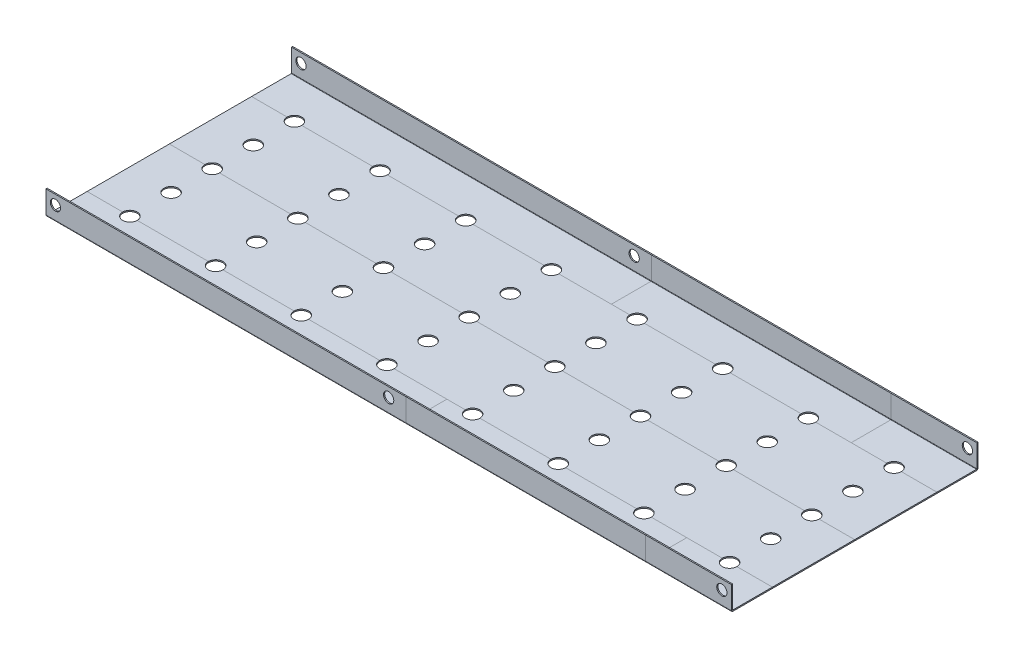
from build123d import *

# Parameters (mm, degrees)
SKETCH_1_W                         = 400
SKETCH_1_H                         = 144
SKETCH_1_R                         = 4.25
SM_BASE_FLANGE_1_DEPTH             = 0.7
SM_EDGE_FLANGE_1_STRIP_W           = 3.2
SM_EDGE_FLANGE_1_STRIP_H           = 0.7
SM_EDGE_FLANGE_1_STRIP_CUT_DEPTH   = 400
SM_EDGE_FLANGE_1_STRIP_2_W         = 3.2
SM_EDGE_FLANGE_1_STRIP_2_H         = 0.7
SM_EDGE_FLANGE_1_STRIP_CUT_2_DEPTH = 400
SM_EDGE_FLANGE_1_DEPTH             = 400
SM_EDGE_FLANGE_1_BEND_DEPTH        = 400
SKETCH_14_R                        = 3
CUT_EXTRUDE_1_DEPTH                = 10
CUT_EXTRUDE_START                  = -10
SKETCH_15_R                        = 3
CUT_EXTRUDE_2_DEPTH                = 10
SPLIT_BODIES_5_OUTLINE_W           = 400
SPLIT_BODIES_5_OUTLINE_H           = 14
SPLIT_BODIES_5_OUTLINE_R           = 3
SPLIT_BODIES_5_DEPTH               = 72
SPLIT_START                        = -72
SPLIT_BODIES_5_2_OUTLINE_W         = 400
SPLIT_BODIES_5_2_OUTLINE_H         = 14
SPLIT_BODIES_5_2_OUTLINE_R         = 3
SPLIT_BODIES_5_2_DEPTH             = 24
SPLIT_START_2                      = 150
SPLIT_BODIES_5_3_DEPTH             = 20.75
SPLIT_START_3                      = 179.25
SPLIT_BODIES_5_4_DEPTH             = 12.2499999
SPLIT_START_4                      = 197.5000001
SPLIT_BODIES_5_5_DEPTH             = 2.4999999
SPLIT_START_5                      = 170.75
SPLIT_BODIES_5_6_DEPTH             = 26.7500001
SPLIT_START_6                      = -0.7
SPLIT_BODIES_5_9_OUTLINE_R         = 4.25
SPLIT_BODIES_5_9_DEPTH             = 0.7
SPLIT_START_7                      = 0.2
SPLIT_BODIES_5_10_OUTLINE_W        = 210
SPLIT_BODIES_5_10_OUTLINE_H        = 0.7
SPLIT_BODIES_5_10_DEPTH            = 4.5999999
SPLIT_START_8                      = 10.8000001
SPLIT_BODIES_5_11_OUTLINE_W        = 210
SPLIT_BODIES_5_11_OUTLINE_H        = 0.7
SPLIT_BODIES_5_11_DEPTH            = 2.4999999
SPLIT_BODIES_5_12_DEPTH            = 0.9
SPLIT_START_9                      = 4.7999999
SPLIT_BODIES_5_13_OUTLINE_W        = 210
SPLIT_BODIES_5_13_OUTLINE_H        = 0.7
SPLIT_BODIES_5_13_DEPTH            = 6.0000002
SPLIT_START_10                     = -201
SPLIT_BODIES_5_14_DEPTH            = 212
SPLIT_START_11                     = 70
SPLIT_BODIES_5_15_OUTLINE_R        = 3
SPLIT_BODIES_5_15_DEPTH            = 3
SPLIT_BODIES_5_16_OUTLINE_W        = 140
SPLIT_BODIES_5_16_OUTLINE_H        = 0.7
SPLIT_BODIES_5_16_DEPTH            = 13.1
SPLIT_START_12                     = 10
SPLIT_BODIES_5_17_DEPTH            = 140
SPLIT_BODIES_5_18_DEPTH            = 0.7
SPLIT_BODIES_5_19_DEPTH            = 20.75
SPLIT_BODIES_5_20_DEPTH            = 12.2499999
SPLIT_BODIES_5_21_DEPTH            = 2.4999999
SPLIT_BODIES_5_22_DEPTH            = 26.7500001
SPLIT_BODIES_5_25_OUTLINE_W        = 140
SPLIT_BODIES_5_25_OUTLINE_H        = 0.7
SPLIT_BODIES_5_25_DEPTH            = 13.1
SPLIT_BODIES_5_26_DEPTH            = 140
SPLIT_BODIES_5_27_DEPTH            = 0.7
SPLIT_BODIES_5_28_OUTLINE_W        = 210
SPLIT_BODIES_5_28_OUTLINE_H        = 0.7
SPLIT_BODIES_5_28_DEPTH            = 4.5999999
SPLIT_BODIES_5_29_OUTLINE_W        = 210
SPLIT_BODIES_5_29_OUTLINE_H        = 0.7
SPLIT_BODIES_5_29_DEPTH            = 2.4999999
SPLIT_BODIES_5_30_DEPTH            = 0.9
SPLIT_BODIES_5_31_OUTLINE_W        = 210
SPLIT_BODIES_5_31_OUTLINE_H        = 0.7
SPLIT_BODIES_5_31_DEPTH            = 6.0000002
SPLIT_BODIES_5_32_DEPTH            = 212
SPLIT_START_13                     = -73
SPLIT_BODIES_5_33_OUTLINE_R        = 3
SPLIT_BODIES_5_33_DEPTH            = 3


with BuildPart() as part:
    # 基体-法兰1: sheet metal written as solids
    # Sketch 1 → 基体-法兰1 (new body)
    with BuildSketch(Plane(origin=(0, 0, 0), x_dir=(1, 0, 0), z_dir=(0, 1, 0))):
        Rectangle(SKETCH_1_W, SKETCH_1_H)
        with Locations(Location((-175, -48, 0), (0, 0, 270))):
            Circle(SKETCH_1_R, mode=Mode.SUBTRACT)
        with Locations(Location((-175, -24, 0), (0, 0, 270))):
            Circle(SKETCH_1_R, mode=Mode.SUBTRACT)
        with Locations(Location((-175, 0, 0), (0, 0, 270))):
            Circle(SKETCH_1_R, mode=Mode.SUBTRACT)
        with Locations(Location((-175, 24, 0), (0, 0, 270))):
            Circle(SKETCH_1_R, mode=Mode.SUBTRACT)
        with Locations(Location((-175, 48, 0), (0, 0, 270))):
            Circle(SKETCH_1_R, mode=Mode.SUBTRACT)
        with Locations(Location((-125, -48, 0), (0, 0, 90))):
            Circle(SKETCH_1_R, mode=Mode.SUBTRACT)
        with Locations(Location((-125, -24, 0), (0, 0, 90))):
            Circle(SKETCH_1_R, mode=Mode.SUBTRACT)
        with Locations(Location((-125, 0, 0), (0, 0, 90))):
            Circle(SKETCH_1_R, mode=Mode.SUBTRACT)
        with Locations(Location((-125, 24, 0), (0, 0, 90))):
            Circle(SKETCH_1_R, mode=Mode.SUBTRACT)
        with Locations(Location((-125, 48, 0), (0, 0, 90))):
            Circle(SKETCH_1_R, mode=Mode.SUBTRACT)
        with Locations(Location((-75, -48, 0), (0, 0, 270))):
            Circle(SKETCH_1_R, mode=Mode.SUBTRACT)
        with Locations(Location((-25, -48, 0), (0, 0, 90))):
            Circle(SKETCH_1_R, mode=Mode.SUBTRACT)
        with Locations(Location((-25, -24, 0), (0, 0, 90))):
            Circle(SKETCH_1_R, mode=Mode.SUBTRACT)
        with Locations(Location((-75, -24, 0), (0, 0, 270))):
            Circle(SKETCH_1_R, mode=Mode.SUBTRACT)
        with Locations(Location((-75, 0, 0), (0, 0, 270))):
            Circle(SKETCH_1_R, mode=Mode.SUBTRACT)
        with Locations(Location((-25, 0, 0), (0, 0, 90))):
            Circle(SKETCH_1_R, mode=Mode.SUBTRACT)
        with Locations(Location((-75, 24, 0), (0, 0, 270))):
            Circle(SKETCH_1_R, mode=Mode.SUBTRACT)
        with Locations(Location((-25, 24, 0), (0, 0, 90))):
            Circle(SKETCH_1_R, mode=Mode.SUBTRACT)
        with Locations(Location((-25, 48, 0), (0, 0, 90))):
            Circle(SKETCH_1_R, mode=Mode.SUBTRACT)
        with Locations(Location((-75, 48, 0), (0, 0, 270))):
            Circle(SKETCH_1_R, mode=Mode.SUBTRACT)
        with Locations(Location((25, 48, 0), (0, 0, 270))):
            Circle(SKETCH_1_R, mode=Mode.SUBTRACT)
        with Locations(Location((25, 24, 0), (0, 0, 270))):
            Circle(SKETCH_1_R, mode=Mode.SUBTRACT)
        with Locations(Location((25, 0, 0), (0, 0, 270))):
            Circle(SKETCH_1_R, mode=Mode.SUBTRACT)
        with Locations(Location((25, -24, 0), (0, 0, 270))):
            Circle(SKETCH_1_R, mode=Mode.SUBTRACT)
        with Locations(Location((25, -48, 0), (0, 0, 270))):
            Circle(SKETCH_1_R, mode=Mode.SUBTRACT)
        with Locations(Location((75, -48, 0), (0, 0, 90))):
            Circle(SKETCH_1_R, mode=Mode.SUBTRACT)
        with Locations(Location((75, -24, 0), (0, 0, 90))):
            Circle(SKETCH_1_R, mode=Mode.SUBTRACT)
        with Locations(Location((75, 0, 0), (0, 0, 90))):
            Circle(SKETCH_1_R, mode=Mode.SUBTRACT)
        with Locations(Location((75, 24, 0), (0, 0, 90))):
            Circle(SKETCH_1_R, mode=Mode.SUBTRACT)
        with Locations(Location((75, 48, 0), (0, 0, 90))):
            Circle(SKETCH_1_R, mode=Mode.SUBTRACT)
        with Locations(Location((125, 48, 0), (0, 0, 270))):
            Circle(SKETCH_1_R, mode=Mode.SUBTRACT)
        with Locations(Location((125, 24, 0), (0, 0, 270))):
            Circle(SKETCH_1_R, mode=Mode.SUBTRACT)
        with Locations(Location((125, 0, 0), (0, 0, 270))):
            Circle(SKETCH_1_R, mode=Mode.SUBTRACT)
        with Locations(Location((125, -24, 0), (0, 0, 270))):
            Circle(SKETCH_1_R, mode=Mode.SUBTRACT)
        with Locations(Location((125, -48, 0), (0, 0, 270))):
            Circle(SKETCH_1_R, mode=Mode.SUBTRACT)
        with Locations(Location((175, -48, 0), (0, 0, 90))):
            Circle(SKETCH_1_R, mode=Mode.SUBTRACT)
        with Locations(Location((175, -24, 0), (0, 0, 90))):
            Circle(SKETCH_1_R, mode=Mode.SUBTRACT)
        with Locations(Location((175, 0, 0), (0, 0, 90))):
            Circle(SKETCH_1_R, mode=Mode.SUBTRACT)
        with Locations(Location((175, 24, 0), (0, 0, 90))):
            Circle(SKETCH_1_R, mode=Mode.SUBTRACT)
        with Locations(Location((175, 48, 0), (0, 0, 90))):
            Circle(SKETCH_1_R, mode=Mode.SUBTRACT)
    extrude(amount=-SM_BASE_FLANGE_1_DEPTH)

    # 边线-法兰1: sheet metal written as solids
    # 边线-法兰1 strip (on a plane across the edge) → 边线-法兰1 strip cut (cut)
    with BuildSketch(Plane(origin=(-200, 0, 72), x_dir=(0, 0, -1), z_dir=(1, 0, 0))):
        with Locations((-0.7, -0.35)):
            Rectangle(SM_EDGE_FLANGE_1_STRIP_W, SM_EDGE_FLANGE_1_STRIP_H)
    extrude(amount=SM_EDGE_FLANGE_1_STRIP_CUT_DEPTH, mode=Mode.SUBTRACT)

    # 边线-法兰1 strip 2 (on a plane across the edge) → 边线-法兰1 strip cut 2 (cut)
    with BuildSketch(Plane(origin=(200, 0, -72), x_dir=(0, 0, 1), z_dir=(-1, 0, 0))):
        with Locations((-0.7, -0.35)):
            Rectangle(SM_EDGE_FLANGE_1_STRIP_2_W, SM_EDGE_FLANGE_1_STRIP_2_H)
    extrude(amount=SM_EDGE_FLANGE_1_STRIP_CUT_2_DEPTH, mode=Mode.SUBTRACT)

    # 边线-法兰1 section (on a plane across the edge) → 边线-法兰1 (add)
    with BuildSketch(Plane(origin=(-200, 0, 72), x_dir=(0, 0, -1), z_dir=(1, 0, 0))):
        with BuildLine():
            Line((0, 0.2), (0, 13.3))
            Line((0, 13.3), (0.7, 13.3))
            Line((0.7, 13.3), (0.7, 0.2))
            ThreePointArc((0.7, 0.2), (0.758578644, 0.058578644), (0.9, 0))
            Line((0.9, 0), (0.9, -0.7))
            ThreePointArc((0.9, -0.7), (0.263603897, -0.436396103), (0, 0.2))
        make_face()
    extrude(amount=SM_EDGE_FLANGE_1_DEPTH)

    # 边线-法兰1 section 2 (on a plane across the edge) → 边线-法兰1 bend (add)
    with BuildSketch(Plane(origin=(200, 0, -72), x_dir=(0, 0, 1), z_dir=(-1, 0, 0))):
        with BuildLine():
            Line((0, 0.2), (0, 13.3))
            Line((0, 13.3), (0.7, 13.3))
            Line((0.7, 13.3), (0.7, 0.2))
            ThreePointArc((0.7, 0.2), (0.758578644, 0.058578644), (0.9, 0))
            Line((0.9, 0), (0.9, -0.7))
            ThreePointArc((0.9, -0.7), (0.263603897, -0.436396103), (0, 0.2))
        make_face()
    extrude(amount=SM_EDGE_FLANGE_1_BEND_DEPTH)

    # Sketch 14 → 切除-拉伸1 (cut)
    with BuildSketch(Plane.XY.offset(72)):
        with Locations((-194.5, 7.8)):
            Circle(SKETCH_14_R)
        with Locations((0, 7.8)):
            Circle(SKETCH_14_R)
        with Locations(Location((194.5, 7.8, 0), (0, 0, 180))):
            Circle(SKETCH_14_R)
    extrude(amount=-CUT_EXTRUDE_1_DEPTH, mode=Mode.SUBTRACT)

    # Sketch 15 → 切除-拉伸2 (cut)
    with BuildSketch(Plane(origin=(0, 0, -72), x_dir=(-1, 0, 0), z_dir=(0, 0, -1)).offset(CUT_EXTRUDE_START)):
        with Locations((-194.5, 7.8)):
            Circle(SKETCH_15_R)
        with Locations(Location((0, 7.8, 0), (0, 0, 180))):
            Circle(SKETCH_15_R)
        with Locations(Location((194.5, 7.8, 0), (0, 0, 180))):
            Circle(SKETCH_15_R)
    extrude(amount=CUT_EXTRUDE_2_DEPTH, mode=Mode.SUBTRACT)

    # Split Bodies 5: read off the stored shape, not the designer's step
    # Split Bodies 5 outline → Split Bodies 5 (cut)
    with BuildSketch(Plane.XY):
        with Locations((0, 6.3)):
            Rectangle(SPLIT_BODIES_5_OUTLINE_W, SPLIT_BODIES_5_OUTLINE_H)
        with Locations((194.5, 7.8)):
            Circle(SPLIT_BODIES_5_OUTLINE_R, mode=Mode.SUBTRACT)
        with Locations((-194.5, 7.8)):
            Circle(SPLIT_BODIES_5_OUTLINE_R, mode=Mode.SUBTRACT)
        with Locations((0, 7.8)):
            Circle(SPLIT_BODIES_5_OUTLINE_R, mode=Mode.SUBTRACT)
    extrude(amount=SPLIT_BODIES_5_DEPTH, mode=Mode.SUBTRACT)

    # Split Bodies 5 2 outline → Split Bodies 5 2 (cut)
    with BuildSketch(Plane.XY.offset(SPLIT_START)):
        with Locations((0, 6.3)):
            Rectangle(SPLIT_BODIES_5_2_OUTLINE_W, SPLIT_BODIES_5_2_OUTLINE_H)
        with Locations((194.5, 7.8)):
            Circle(SPLIT_BODIES_5_2_OUTLINE_R, mode=Mode.SUBTRACT)
        with Locations((-194.5, 7.8)):
            Circle(SPLIT_BODIES_5_2_OUTLINE_R, mode=Mode.SUBTRACT)
        with Locations((0, 7.8)):
            Circle(SPLIT_BODIES_5_2_OUTLINE_R, mode=Mode.SUBTRACT)
    extrude(amount=SPLIT_BODIES_5_2_DEPTH, mode=Mode.SUBTRACT)


with BuildPart() as body_2:
    # Split Bodies 5 3 outline → Split Bodies 5 3 (new body)
    with BuildSketch(Plane.YZ.offset(SPLIT_START_2)):
        with BuildLine():
            Line((-0.7, 71.1), (-0.7, 48))
            Line((-0.7, 48), (0, 48))
            Line((0, 48), (0, 71.1))
            ThreePointArc((0, 71.1), (0.058578644, 71.241421356), (0.2, 71.3))
            Line((0.2, 71.3), (13.3, 71.3))
            Line((13.3, 71.3), (13.3, 72))
            Line((13.3, 72), (0.2, 72))
            ThreePointArc((0.2, 72), (-0.436396103, 71.736396103), (-0.7, 71.1))
        make_face()
    extrude(amount=SPLIT_BODIES_5_3_DEPTH)

    # Split Bodies 5 4 outline → Split Bodies 5 4 (add)
    with BuildSketch(Plane.YZ.offset(SPLIT_START_3)):
        with BuildLine():
            Line((-0.7, 71.1), (-0.7, 48))
            Line((-0.7, 48), (0, 48))
            Line((0, 48), (0, 71.1))
            ThreePointArc((0, 71.1), (0.058578644, 71.241421356), (0.2, 71.3))
            Line((0.2, 71.3), (13.3, 71.3))
            Line((13.3, 71.3), (13.3, 72))
            Line((13.3, 72), (0.2, 72))
            ThreePointArc((0.2, 72), (-0.436396103, 71.736396103), (-0.7, 71.1))
        make_face()
    extrude(amount=SPLIT_BODIES_5_4_DEPTH)

    # Split Bodies 5 5 outline → Split Bodies 5 5 (add)
    with BuildSketch(Plane.YZ.offset(SPLIT_START_4)):
        with BuildLine():
            Line((-0.7, 71.1), (-0.7, 48))
            Line((-0.7, 48), (0, 48))
            Line((0, 48), (0, 71.1))
            ThreePointArc((0, 71.1), (0.058578644, 71.241421356), (0.2, 71.3))
            Line((0.2, 71.3), (13.3, 71.3))
            Line((13.3, 71.3), (13.3, 72))
            Line((13.3, 72), (0.2, 72))
            ThreePointArc((0.2, 72), (-0.436396103, 71.736396103), (-0.7, 71.1))
        make_face()
    extrude(amount=SPLIT_BODIES_5_5_DEPTH)

    # Split Bodies 5 6 outline → Split Bodies 5 6 (add)
    with BuildSketch(Plane.YZ.offset(SPLIT_START_5)):
        with BuildLine():
            Line((-0.7, 71.1), (-0.7, 48))
            Line((-0.7, 48), (0, 48))
            Line((0, 48), (0, 71.1))
            ThreePointArc((0, 71.1), (0.058578644, 71.241421356), (0.2, 71.3))
            Line((0.2, 71.3), (13.3, 71.3))
            Line((13.3, 71.3), (13.3, 72))
            Line((13.3, 72), (0.2, 72))
            ThreePointArc((0.2, 72), (-0.436396103, 71.736396103), (-0.7, 71.1))
        make_face()
    extrude(amount=SPLIT_BODIES_5_6_DEPTH)

    # Split Bodies 5 7: loft between two sections, ruled curve by curve
    split_bodies_5_7_from = [
        Edge.make_three_point_arc((191.5, 7.8, 71.3), (194.5, 4.8, 71.3), (197.5, 7.8, 71.3)),
        Edge.make_three_point_arc((197.5, 7.8, 71.3), (194.5, 10.8, 71.3), (191.5, 7.8, 71.3)),
    ]
    split_bodies_5_7_to = [
        Edge.make_three_point_arc((191.5, 7.8, 72), (194.5, 4.8, 72), (197.5, 7.8, 72)),
        Edge.make_three_point_arc((197.5, 7.8, 72), (194.5, 10.8, 72), (191.5, 7.8, 72)),
    ]
    split_bodies_5_7 = Solid(Shell([*[Face.make_surface_from_curves(split_bodies_5_7_from[k], split_bodies_5_7_to[k]) for k in range(2)], Face(Wire(split_bodies_5_7_from)), Face(Wire(split_bodies_5_7_to))]))
    add(split_bodies_5_7, mode=Mode.SUBTRACT)

    # Split Bodies 5 8: loft between two sections, ruled curve by curve
    split_bodies_5_8_from = [
        Edge.make_three_point_arc((170.75, -0.7, 48), (171.99479618, -0.7, 51.00520382), (175, -0.7, 52.25)),
        Edge.make_three_point_arc((175, -0.7, 52.25), (178.00520382, -0.7, 51.00520382), (179.25, -0.7, 48)),
        Edge.make_line((179.25, -0.7, 48), (170.75, -0.7, 48)),
    ]
    split_bodies_5_8_to = [
        Edge.make_three_point_arc((170.75, 0, 48), (171.99479618, 0, 51.00520382), (175, 0, 52.25)),
        Edge.make_three_point_arc((175, 0, 52.25), (178.00520382, 0, 51.00520382), (179.25, 0, 48)),
        Edge.make_line((179.25, 0, 48), (170.75, 0, 48)),
    ]
    split_bodies_5_8 = Solid(Shell([*[Face.make_surface_from_curves(split_bodies_5_8_from[k], split_bodies_5_8_to[k]) for k in range(3)], Face(Wire(split_bodies_5_8_from)), Face(Wire(split_bodies_5_8_to))]))
    add(split_bodies_5_8, mode=Mode.SUBTRACT)


with BuildPart() as body_3:
    # Split Bodies 5 9 outline → Split Bodies 5 9 (new body)
    with BuildSketch(Plane(origin=(0, 0, 0), x_dir=(1, 0, 0), z_dir=(0, 1, 0)).offset(SPLIT_START_6)):
        with BuildLine():
            Line((-200, -48), (-179.25, -48))
            ThreePointArc((-179.25, -48), (-175, -43.75), (-170.75, -48))
            Line((-170.75, -48), (-129.25, -48))
            ThreePointArc((-129.25, -48), (-125, -43.75), (-120.75, -48))
            Line((-120.75, -48), (-79.25, -48))
            ThreePointArc((-79.25, -48), (-75, -43.75), (-70.75, -48))
            Line((-70.75, -48), (-29.25, -48))
            ThreePointArc((-29.25, -48), (-25, -43.75), (-20.75, -48))
            Line((-20.75, -48), (20.75, -48))
            ThreePointArc((20.75, -48), (25, -43.75), (29.25, -48))
            Line((29.25, -48), (70.75, -48))
            ThreePointArc((70.75, -48), (75, -43.75), (79.25, -48))
            Line((79.25, -48), (120.75, -48))
            ThreePointArc((120.75, -48), (125, -43.75), (129.25, -48))
            Line((129.25, -48), (170.75, -48))
            ThreePointArc((170.75, -48), (175, -43.75), (179.25, -48))
            Line((179.25, -48), (200, -48))
            Line((200, -48), (200, 0))
            Line((200, 0), (179.25, 0))
            ThreePointArc((179.25, 0), (175, -4.25), (170.75, 0))
            Line((170.75, 0), (129.25, 0))
            ThreePointArc((129.25, 0), (125, -4.25), (120.75, 0))
            Line((120.75, 0), (79.25, 0))
            ThreePointArc((79.25, 0), (75, -4.25), (70.75, 0))
            Line((70.75, 0), (29.25, 0))
            ThreePointArc((29.25, 0), (25, -4.25), (20.75, 0))
            Line((20.75, 0), (-20.75, 0))
            ThreePointArc((-20.75, 0), (-25, -4.25), (-29.25, 0))
            Line((-29.25, 0), (-70.75, 0))
            ThreePointArc((-70.75, 0), (-75, -4.25), (-79.25, 0))
            Line((-79.25, 0), (-120.75, 0))
            ThreePointArc((-120.75, 0), (-125, -4.25), (-129.25, 0))
            Line((-129.25, 0), (-170.75, 0))
            ThreePointArc((-170.75, 0), (-175, -4.25), (-179.25, 0))
            Line((-179.25, 0), (-200, 0))
            Line((-200, 0), (-200, -48))
        make_face()
        with Locations((-175, -24)):
            Circle(SPLIT_BODIES_5_9_OUTLINE_R, mode=Mode.SUBTRACT)
        with Locations((-125, -24)):
            Circle(SPLIT_BODIES_5_9_OUTLINE_R, mode=Mode.SUBTRACT)
        with Locations((-75, -24)):
            Circle(SPLIT_BODIES_5_9_OUTLINE_R, mode=Mode.SUBTRACT)
        with Locations((-25, -24)):
            Circle(SPLIT_BODIES_5_9_OUTLINE_R, mode=Mode.SUBTRACT)
        with Locations((25, -24)):
            Circle(SPLIT_BODIES_5_9_OUTLINE_R, mode=Mode.SUBTRACT)
        with Locations((75, -24)):
            Circle(SPLIT_BODIES_5_9_OUTLINE_R, mode=Mode.SUBTRACT)
        with Locations((125, -24)):
            Circle(SPLIT_BODIES_5_9_OUTLINE_R, mode=Mode.SUBTRACT)
        with Locations((175, -24)):
            Circle(SPLIT_BODIES_5_9_OUTLINE_R, mode=Mode.SUBTRACT)
    extrude(amount=SPLIT_BODIES_5_9_DEPTH)


with BuildPart() as body_4:
    # Split Bodies 5 10 outline → Split Bodies 5 10 (new body)
    with BuildSketch(Plane(origin=(0, 0, 0), x_dir=(1, 0, 0), z_dir=(0, 1, 0)).offset(SPLIT_START_7)):
        with Locations((-95, -71.65)):
            Rectangle(SPLIT_BODIES_5_10_OUTLINE_W, SPLIT_BODIES_5_10_OUTLINE_H)
    extrude(amount=SPLIT_BODIES_5_10_DEPTH)

    # Split Bodies 5 11 outline → Split Bodies 5 11 (add)
    with BuildSketch(Plane(origin=(0, 0, 0), x_dir=(1, 0, 0), z_dir=(0, 1, 0)).offset(SPLIT_START_8)):
        with Locations((-95, -71.65)):
            Rectangle(SPLIT_BODIES_5_11_OUTLINE_W, SPLIT_BODIES_5_11_OUTLINE_H)
    extrude(amount=SPLIT_BODIES_5_11_DEPTH)

    # Split Bodies 5 12 outline → Split Bodies 5 12 (add)
    with BuildSketch(Plane(origin=(0, 0, 0), x_dir=(1, 0, 0), z_dir=(0, 1, 0)).offset(SPLIT_START_6)):
        with BuildLine():
            Line((10, -48), (-20.75, -48))
            ThreePointArc((-20.75, -48), (-25, -52.25), (-29.25, -48))
            Line((-29.25, -48), (-70.75, -48))
            ThreePointArc((-70.75, -48), (-75, -52.25), (-79.25, -48))
            Line((-79.25, -48), (-120.75, -48))
            ThreePointArc((-120.75, -48), (-125, -52.25), (-129.25, -48))
            Line((-129.25, -48), (-170.75, -48))
            ThreePointArc((-170.75, -48), (-175, -52.25), (-179.25, -48))
            Line((-179.25, -48), (-200, -48))
            Line((-200, -48), (-200, -72))
            Line((-200, -72), (10, -72))
            Line((10, -72), (10, -48))
        make_face()
    extrude(amount=SPLIT_BODIES_5_12_DEPTH)

    # Split Bodies 5 13 outline → Split Bodies 5 13 (add)
    with BuildSketch(Plane(origin=(0, 0, 0), x_dir=(1, 0, 0), z_dir=(0, 1, 0)).offset(SPLIT_START_9)):
        with Locations((-95, -71.65)):
            Rectangle(SPLIT_BODIES_5_13_OUTLINE_W, SPLIT_BODIES_5_13_OUTLINE_H)
    extrude(amount=SPLIT_BODIES_5_13_DEPTH)

    # Split Bodies 5 14 outline → Split Bodies 5 14 (cut)
    with BuildSketch(Plane.YZ.offset(SPLIT_START_10)):
        with BuildLine():
            Line((0, 71.1), (0, 48))
            Line((0, 48), (0.2, 48))
            Line((0.2, 48), (0.2, 71.3))
            ThreePointArc((0.2, 71.3), (0.058578644, 71.241421356), (0, 71.1))
        make_face()
        with BuildLine():
            Line((-0.7, 72), (-0.7, 71.1))
            ThreePointArc((-0.7, 71.1), (-0.436396103, 71.736396103), (0.2, 72))
            Line((0.2, 72), (-0.7, 72))
        make_face()
    extrude(amount=SPLIT_BODIES_5_14_DEPTH, mode=Mode.SUBTRACT)

    # Split Bodies 5 15 outline → Split Bodies 5 15 (cut)
    with BuildSketch(Plane.XY.offset(SPLIT_START_11)):
        with Locations((0, 7.8)):
            Circle(SPLIT_BODIES_5_15_OUTLINE_R)
        with Locations((-194.5, 7.8)):
            Circle(SPLIT_BODIES_5_15_OUTLINE_R)
    extrude(amount=SPLIT_BODIES_5_15_DEPTH, mode=Mode.SUBTRACT)


with BuildPart() as body_5:
    # Split Bodies 5 16 outline → Split Bodies 5 16 (new body)
    with BuildSketch(Plane(origin=(0, 0, 0), x_dir=(1, 0, 0), z_dir=(0, 1, 0)).offset(SPLIT_START_7)):
        with Locations((80, -71.65)):
            Rectangle(SPLIT_BODIES_5_16_OUTLINE_W, SPLIT_BODIES_5_16_OUTLINE_H)
    extrude(amount=SPLIT_BODIES_5_16_DEPTH)

    # Split Bodies 5 17 outline → Split Bodies 5 17 (add)
    with BuildSketch(Plane.YZ.offset(SPLIT_START_12)):
        with BuildLine():
            Line((-0.7, 71.1), (-0.7, 48))
            Line((-0.7, 48), (0, 48))
            Line((0, 48), (0, 71.1))
            ThreePointArc((0, 71.1), (0.058578644, 71.241421356), (0.2, 71.3))
            Line((0.2, 71.3), (0.2, 72))
            ThreePointArc((0.2, 72), (-0.436396103, 71.736396103), (-0.7, 71.1))
        make_face()
    extrude(amount=SPLIT_BODIES_5_17_DEPTH)

    # Split Bodies 5 18 outline → Split Bodies 5 18 (cut)
    with BuildSketch(Plane(origin=(0, 0, 0), x_dir=(1, 0, 0), z_dir=(0, 1, 0)).offset(SPLIT_START_6)):
        with BuildLine():
            Line((129.25, -48), (120.75, -48))
            ThreePointArc((120.75, -48), (125, -52.25), (129.25, -48))
        make_face()
        with BuildLine():
            ThreePointArc((20.75, -48), (25, -52.25), (29.25, -48))
            Line((29.25, -48), (20.75, -48))
        make_face()
        with BuildLine():
            ThreePointArc((70.75, -48), (75, -52.25), (79.25, -48))
            Line((79.25, -48), (70.75, -48))
        make_face()
    extrude(amount=SPLIT_BODIES_5_18_DEPTH, mode=Mode.SUBTRACT)


with BuildPart() as body_6:
    # Split Bodies 5 19 outline → Split Bodies 5 19 (new body)
    with BuildSketch(Plane.YZ.offset(SPLIT_START_2)):
        with BuildLine():
            Line((0, -48), (-0.7, -48))
            Line((-0.7, -48), (-0.7, -71.1))
            ThreePointArc((-0.7, -71.1), (-0.436396103, -71.736396103), (0.2, -72))
            Line((0.2, -72), (13.3, -72))
            Line((13.3, -72), (13.3, -71.3))
            Line((13.3, -71.3), (0.2, -71.3))
            ThreePointArc((0.2, -71.3), (0.058578644, -71.241421356), (0, -71.1))
            Line((0, -71.1), (0, -48))
        make_face()
    extrude(amount=SPLIT_BODIES_5_19_DEPTH)

    # Split Bodies 5 20 outline → Split Bodies 5 20 (add)
    with BuildSketch(Plane.YZ.offset(SPLIT_START_3)):
        with BuildLine():
            Line((0, -48), (-0.7, -48))
            Line((-0.7, -48), (-0.7, -71.1))
            ThreePointArc((-0.7, -71.1), (-0.436396103, -71.736396103), (0.2, -72))
            Line((0.2, -72), (13.3, -72))
            Line((13.3, -72), (13.3, -71.3))
            Line((13.3, -71.3), (0.2, -71.3))
            ThreePointArc((0.2, -71.3), (0.058578644, -71.241421356), (0, -71.1))
            Line((0, -71.1), (0, -48))
        make_face()
    extrude(amount=SPLIT_BODIES_5_20_DEPTH)

    # Split Bodies 5 21 outline → Split Bodies 5 21 (add)
    with BuildSketch(Plane.YZ.offset(SPLIT_START_4)):
        with BuildLine():
            Line((0, -48), (-0.7, -48))
            Line((-0.7, -48), (-0.7, -71.1))
            ThreePointArc((-0.7, -71.1), (-0.436396103, -71.736396103), (0.2, -72))
            Line((0.2, -72), (13.3, -72))
            Line((13.3, -72), (13.3, -71.3))
            Line((13.3, -71.3), (0.2, -71.3))
            ThreePointArc((0.2, -71.3), (0.058578644, -71.241421356), (0, -71.1))
            Line((0, -71.1), (0, -48))
        make_face()
    extrude(amount=SPLIT_BODIES_5_21_DEPTH)

    # Split Bodies 5 22 outline → Split Bodies 5 22 (add)
    with BuildSketch(Plane.YZ.offset(SPLIT_START_5)):
        with BuildLine():
            Line((0, -48), (-0.7, -48))
            Line((-0.7, -48), (-0.7, -71.1))
            ThreePointArc((-0.7, -71.1), (-0.436396103, -71.736396103), (0.2, -72))
            Line((0.2, -72), (13.3, -72))
            Line((13.3, -72), (13.3, -71.3))
            Line((13.3, -71.3), (0.2, -71.3))
            ThreePointArc((0.2, -71.3), (0.058578644, -71.241421356), (0, -71.1))
            Line((0, -71.1), (0, -48))
        make_face()
    extrude(amount=SPLIT_BODIES_5_22_DEPTH)

    # Split Bodies 5 23: loft between two sections, ruled curve by curve
    split_bodies_5_23_from = [
        Edge.make_three_point_arc((194.5, 10.8, -71.3), (197.5, 7.8, -71.3), (194.5, 4.8, -71.3)),
        Edge.make_three_point_arc((194.5, 4.8, -71.3), (191.5, 7.8, -71.3), (194.5, 10.8, -71.3)),
    ]
    split_bodies_5_23_to = [
        Edge.make_three_point_arc((194.5, 10.8, -72), (197.5, 7.8, -72), (194.5, 4.8, -72)),
        Edge.make_three_point_arc((194.5, 4.8, -72), (191.5, 7.8, -72), (194.5, 10.8, -72)),
    ]
    split_bodies_5_23 = Solid(Shell([*[Face.make_surface_from_curves(split_bodies_5_23_from[k], split_bodies_5_23_to[k]) for k in range(2)], Face(Wire(split_bodies_5_23_from)), Face(Wire(split_bodies_5_23_to))]))
    add(split_bodies_5_23, mode=Mode.SUBTRACT)

    # Split Bodies 5 24: loft between two sections, ruled curve by curve
    split_bodies_5_24_from = [
        Edge.make_three_point_arc((179.25, -0.7, -48), (178.00520382, -0.7, -51.00520382), (175, -0.7, -52.25)),
        Edge.make_three_point_arc((175, -0.7, -52.25), (171.99479618, -0.7, -51.00520382), (170.75, -0.7, -48)),
        Edge.make_line((170.75, -0.7, -48), (179.25, -0.7, -48)),
    ]
    split_bodies_5_24_to = [
        Edge.make_three_point_arc((179.25, 0, -48), (178.00520382, 0, -51.00520382), (175, 0, -52.25)),
        Edge.make_three_point_arc((175, 0, -52.25), (171.99479618, 0, -51.00520382), (170.75, 0, -48)),
        Edge.make_line((170.75, 0, -48), (179.25, 0, -48)),
    ]
    split_bodies_5_24 = Solid(Shell([*[Face.make_surface_from_curves(split_bodies_5_24_from[k], split_bodies_5_24_to[k]) for k in range(3)], Face(Wire(split_bodies_5_24_from)), Face(Wire(split_bodies_5_24_to))]))
    add(split_bodies_5_24, mode=Mode.SUBTRACT)


with BuildPart() as body_7:
    # Split Bodies 5 25 outline → Split Bodies 5 25 (new body)
    with BuildSketch(Plane(origin=(0, 0, 0), x_dir=(1, 0, 0), z_dir=(0, 1, 0)).offset(SPLIT_START_7)):
        with Locations((80, 71.65)):
            Rectangle(SPLIT_BODIES_5_25_OUTLINE_W, SPLIT_BODIES_5_25_OUTLINE_H)
    extrude(amount=SPLIT_BODIES_5_25_DEPTH)

    # Split Bodies 5 26 outline → Split Bodies 5 26 (add)
    with BuildSketch(Plane.YZ.offset(SPLIT_START_12)):
        with BuildLine():
            Line((0, -48), (-0.7, -48))
            Line((-0.7, -48), (-0.7, -71.1))
            ThreePointArc((-0.7, -71.1), (-0.436396103, -71.736396103), (0.2, -72))
            Line((0.2, -72), (0.2, -71.3))
            ThreePointArc((0.2, -71.3), (0.058578644, -71.241421356), (0, -71.1))
            Line((0, -71.1), (0, -48))
        make_face()
    extrude(amount=SPLIT_BODIES_5_26_DEPTH)

    # Split Bodies 5 27 outline → Split Bodies 5 27 (cut)
    with BuildSketch(Plane(origin=(0, 0, 0), x_dir=(1, 0, 0), z_dir=(0, 1, 0)).offset(SPLIT_START_6)):
        with BuildLine():
            Line((120.75, 48), (129.25, 48))
            ThreePointArc((129.25, 48), (125, 52.25), (120.75, 48))
        make_face()
        with BuildLine():
            Line((20.75, 48), (29.25, 48))
            ThreePointArc((29.25, 48), (25, 52.25), (20.75, 48))
        make_face()
        with BuildLine():
            Line((70.75, 48), (79.25, 48))
            ThreePointArc((79.25, 48), (75, 52.25), (70.75, 48))
        make_face()
    extrude(amount=SPLIT_BODIES_5_27_DEPTH, mode=Mode.SUBTRACT)


with BuildPart() as body_8:
    # Split Bodies 5 28 outline → Split Bodies 5 28 (new body)
    with BuildSketch(Plane(origin=(0, 0, 0), x_dir=(1, 0, 0), z_dir=(0, 1, 0)).offset(SPLIT_START_7)):
        with Locations((-95, 71.65)):
            Rectangle(SPLIT_BODIES_5_28_OUTLINE_W, SPLIT_BODIES_5_28_OUTLINE_H)
    extrude(amount=SPLIT_BODIES_5_28_DEPTH)

    # Split Bodies 5 29 outline → Split Bodies 5 29 (add)
    with BuildSketch(Plane(origin=(0, 0, 0), x_dir=(1, 0, 0), z_dir=(0, 1, 0)).offset(SPLIT_START_8)):
        with Locations((-95, 71.65)):
            Rectangle(SPLIT_BODIES_5_29_OUTLINE_W, SPLIT_BODIES_5_29_OUTLINE_H)
    extrude(amount=SPLIT_BODIES_5_29_DEPTH)

    # Split Bodies 5 30 outline → Split Bodies 5 30 (add)
    with BuildSketch(Plane(origin=(0, 0, 0), x_dir=(1, 0, 0), z_dir=(0, 1, 0)).offset(SPLIT_START_6)):
        with BuildLine():
            Line((-200, 48), (-179.25, 48))
            ThreePointArc((-179.25, 48), (-175, 52.25), (-170.75, 48))
            Line((-170.75, 48), (-129.25, 48))
            ThreePointArc((-129.25, 48), (-125, 52.25), (-120.75, 48))
            Line((-120.75, 48), (-79.25, 48))
            ThreePointArc((-79.25, 48), (-75, 52.25), (-70.75, 48))
            Line((-70.75, 48), (-29.25, 48))
            ThreePointArc((-29.25, 48), (-25, 52.25), (-20.75, 48))
            Line((-20.75, 48), (10, 48))
            Line((10, 48), (10, 72))
            Line((10, 72), (-200, 72))
            Line((-200, 72), (-200, 48))
        make_face()
    extrude(amount=SPLIT_BODIES_5_30_DEPTH)

    # Split Bodies 5 31 outline → Split Bodies 5 31 (add)
    with BuildSketch(Plane(origin=(0, 0, 0), x_dir=(1, 0, 0), z_dir=(0, 1, 0)).offset(SPLIT_START_9)):
        with Locations((-95, 71.65)):
            Rectangle(SPLIT_BODIES_5_31_OUTLINE_W, SPLIT_BODIES_5_31_OUTLINE_H)
    extrude(amount=SPLIT_BODIES_5_31_DEPTH)

    # Split Bodies 5 32 outline → Split Bodies 5 32 (cut)
    with BuildSketch(Plane.YZ.offset(SPLIT_START_10)):
        with BuildLine():
            ThreePointArc((0.2, -72), (-0.436396103, -71.736396103), (-0.7, -71.1))
            Line((-0.7, -71.1), (-0.7, -72))
            Line((-0.7, -72), (0.2, -72))
        make_face()
        with BuildLine():
            Line((0, -48), (0, -71.1))
            ThreePointArc((0, -71.1), (0.058578644, -71.241421356), (0.2, -71.3))
            Line((0.2, -71.3), (0.2, -48))
            Line((0.2, -48), (0, -48))
        make_face()
    extrude(amount=SPLIT_BODIES_5_32_DEPTH, mode=Mode.SUBTRACT)

    # Split Bodies 5 33 outline → Split Bodies 5 33 (cut)
    with BuildSketch(Plane.XY.offset(SPLIT_START_13)):
        with Locations((0, 7.8)):
            Circle(SPLIT_BODIES_5_33_OUTLINE_R)
        with Locations((-194.5, 7.8)):
            Circle(SPLIT_BODIES_5_33_OUTLINE_R)
    extrude(amount=SPLIT_BODIES_5_33_DEPTH, mode=Mode.SUBTRACT)


solid = Compound([part.part, body_2.part, body_3.part, body_4.part, body_5.part, body_6.part, body_7.part, body_8.part])
